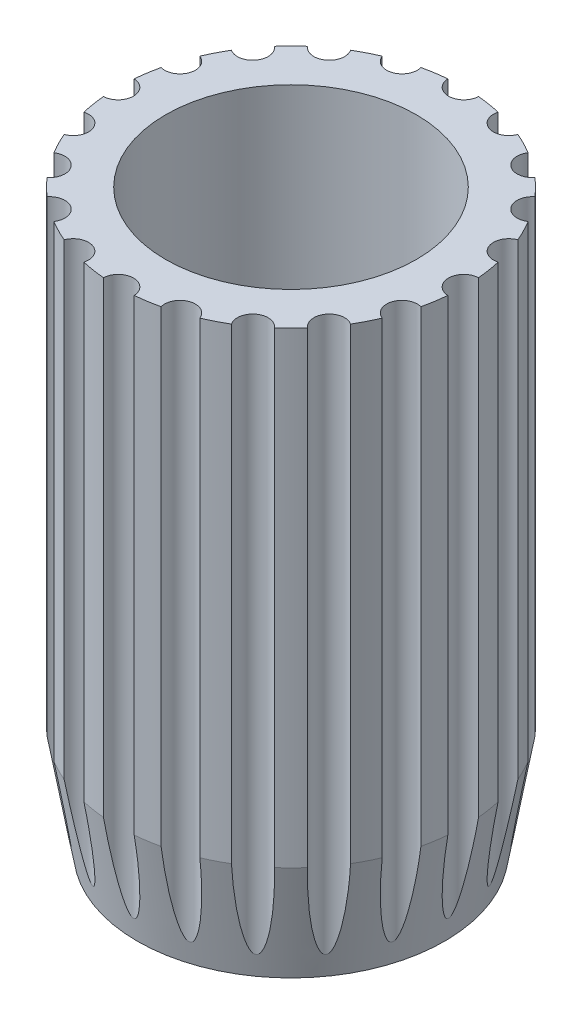
from build123d import *

# Parameters (mm, degrees)
SKETCH1_R                    = 4.5
BOSS_EXTRUDE1_DEPTH          = 15
F_5_16_18_TAPPED_HOLE1_D     = 6.5278
F_5_16_18_TAPPED_HOLE1_DEPTH = 10
F_5_16_18_TAPPED_HOLE1_TIP   = 1.961148974
CHAMFER1_SIZE                = 0.5
CHAMFER1_SIZE2               = 2.83564091
SKETCH5_R                    = 0.4
CUT_EXTRUDE2_DEPTH           = 17.294170737


# Read off the part's stored shape, not the designer's step: Cut-Loft1
with BuildPart() as part:
    # Sketch1 → Boss-Extrude1 (new body)
    with BuildSketch(Plane(origin=(0, 0, 0), x_dir=(1, 0, 0), z_dir=(0, 1, 0))):
        with Locations(Location((0, 0, 0), (0, 0, 270))):
            Circle(SKETCH1_R)
    extrude(amount=BOSS_EXTRUDE1_DEPTH)

    # 5/16-18 Tapped Hole1
    with Locations(Plane(origin=(0, 15, 0), x_dir=(1, 0, 0), z_dir=(0, 1, 0))):
        with Locations((0, 0)):
            Hole(F_5_16_18_TAPPED_HOLE1_D / 2, depth=F_5_16_18_TAPPED_HOLE1_DEPTH)
            with Locations((0, 0, -(F_5_16_18_TAPPED_HOLE1_DEPTH + F_5_16_18_TAPPED_HOLE1_TIP / 2))):  # 118° drill point
                Cone(0, F_5_16_18_TAPPED_HOLE1_D / 2, F_5_16_18_TAPPED_HOLE1_TIP, mode=Mode.SUBTRACT)

    # Cut-Loft1 outline → Cut-Loft1 (revolve, cut)
    with BuildSketch(Plane.XY):
        Polygon((2.5, 0), (3.2639, 5), (0, 3.038851026), (0, 0), align=None)
    revolve(axis=Axis((0, 0, 0), (0, 1, 0)), mode=Mode.SUBTRACT)

    # Chamfer1
    chamfer1_edges = [part.edges().sort_by_distance(p)[0] for p in [
        (0, 0, -4.5),
    ]]
    chamfer1_side = [part.faces().sort_by_distance(p)[0] for p in [
        (0, 0, -4.372720779),
    ]]
    chamfer(chamfer1_edges, length=CHAMFER1_SIZE, length2=CHAMFER1_SIZE2, reference=chamfer1_side[0])

    # Sketch5 → Cut-Extrude2 (cut, through all)
    with BuildSketch(Plane(origin=(0, 15, 0), x_dir=(1, 0, 0), z_dir=(0, 1, 0))):
        with Locations((0, 4.5)):
            Circle(SKETCH5_R)
        with Locations((1.390576475, 4.279754323)):
            Circle(SKETCH5_R)
        with Locations((2.645033635, 3.640576475)):
            Circle(SKETCH5_R)
        with Locations((3.640576475, 2.645033635)):
            Circle(SKETCH5_R)
        with Locations((4.279754323, 1.390576475)):
            Circle(SKETCH5_R)
        with Locations((4.5, 0)):
            Circle(SKETCH5_R)
        with Locations((4.279754323, -1.390576475)):
            Circle(SKETCH5_R)
        with Locations((3.640576475, -2.645033635)):
            Circle(SKETCH5_R)
        with Locations((2.645033635, -3.640576475)):
            Circle(SKETCH5_R)
        with Locations((1.390576475, -4.279754323)):
            Circle(SKETCH5_R)
        with Locations((0, -4.5)):
            Circle(SKETCH5_R)
        with Locations((-1.390576475, -4.279754323)):
            Circle(SKETCH5_R)
        with Locations((-2.645033635, -3.640576475)):
            Circle(SKETCH5_R)
        with Locations((-3.640576475, -2.645033635)):
            Circle(SKETCH5_R)
        with Locations((-4.279754323, -1.390576475)):
            Circle(SKETCH5_R)
        with Locations((-4.5, 0)):
            Circle(SKETCH5_R)
        with Locations((-4.279754323, 1.390576475)):
            Circle(SKETCH5_R)
        with Locations((-3.640576475, 2.645033635)):
            Circle(SKETCH5_R)
        with Locations((-2.645033635, 3.640576475)):
            Circle(SKETCH5_R)
        with Locations((-1.390576475, 4.279754323)):
            Circle(SKETCH5_R)
    extrude(amount=-CUT_EXTRUDE2_DEPTH, mode=Mode.SUBTRACT)


solid = part.part
